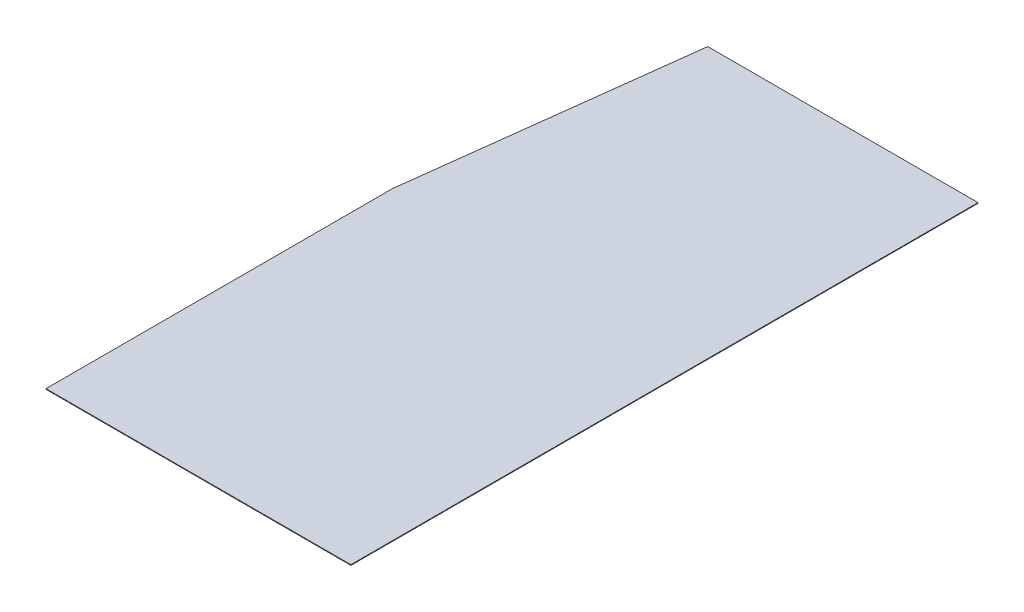
from build123d import *

# Parameters (mm, degrees)
SALIENTE_EXTRUIR1_DEPTH = 1.9


with BuildPart() as part:
    # Croquis2 → Saliente-Extruir1 (new body)
    with BuildSketch(Plane(origin=(0, 0, 0), x_dir=(1, 0, 0), z_dir=(0, 1, 0))):
        Polygon((440, 0), (-440, 0), (-440, 1000), (-340, 1810), (440, 1810), align=None)
    extrude(amount=SALIENTE_EXTRUIR1_DEPTH)


solid = part.part
